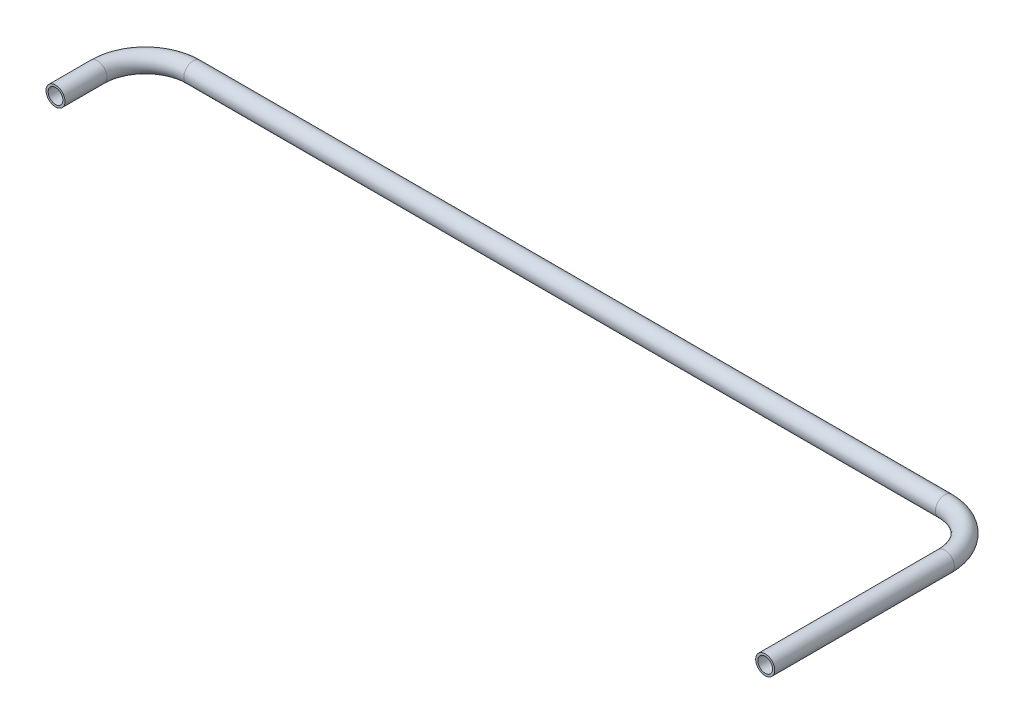
from build123d import *

# Parameters (mm, degrees)
SKETCH2_R   = 3.175
SKETCH2_R_2 = 2.4638


with BuildPart() as part:
    # Sweep-Thin1: sweep along a path in Sketch1
    with BuildLine(Plane(origin=(0, 0, 0), x_dir=(1, 0, 0), z_dir=(0, 1, 0))) as sweep_thin1_path:
        Line((0, 0), (0, 14))
        ThreePointArc((0, 14), (4.686291501, 25.313708499), (16, 30))
        Line((16, 30), (267, 30))
        ThreePointArc((267, 30), (278.313708499, 25.313708499), (283, 14))
        Line((283, 14), (283, -46))
    # Sketch2 → Sweep-Thin1 (sweep)
    with BuildSketch(Plane.XY):
        Circle(SKETCH2_R)
        Circle(SKETCH2_R_2, mode=Mode.SUBTRACT)
    sweep(path=sweep_thin1_path.line)


solid = part.part
